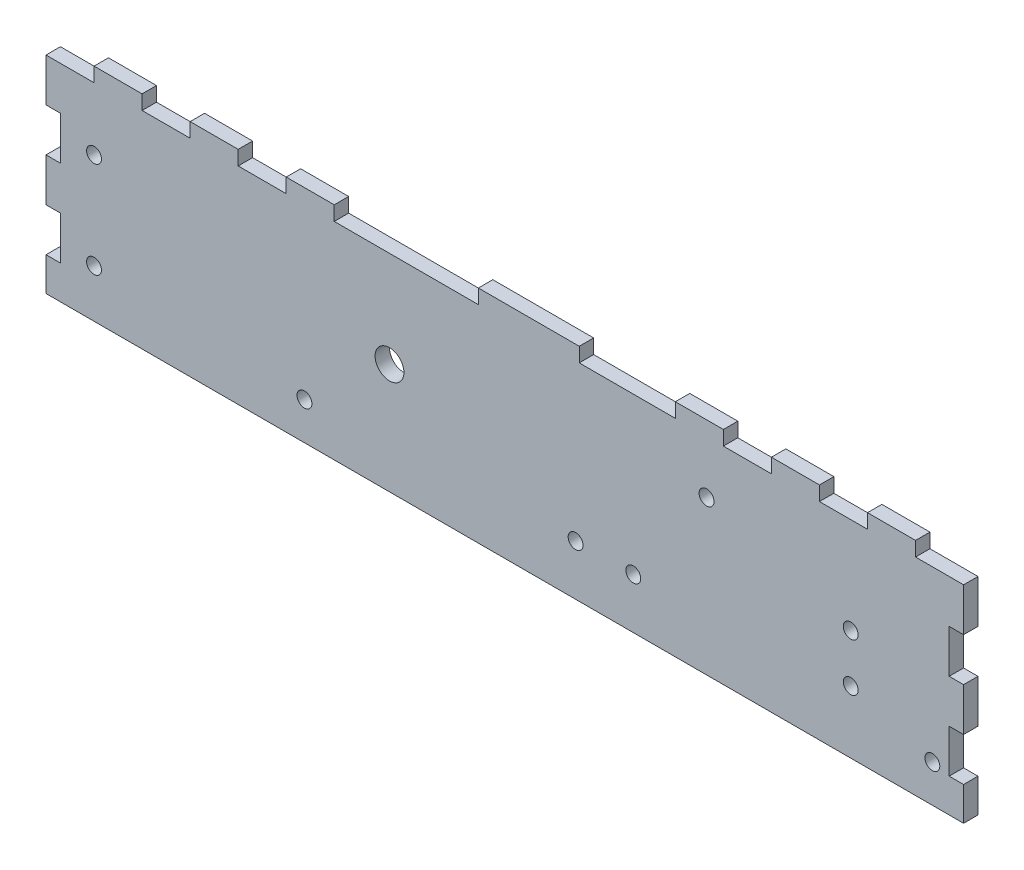
from build123d import *

# Parameters (mm, degrees)
SKETCH1_W           = 191
SKETCH1_H           = 46
SKETCH1_R           = 1.549999948
BOSS_EXTRUDE1_DEPTH = 3
CUT_EXTRUDE1_REACH  = 198.484
SKETCH3_W           = 10
SKETCH3_H           = 3
SKETCH3_W_2         = 30
SKETCH3_W_3         = 20
CUT_EXTRUDE2_REACH  = 198.484
SKETCH4_W           = 3
SKETCH4_H           = 9
CUT_EXTRUDE3_REACH  = 198.484
SKETCH6_R           = 3
CUT_EXTRUDE4_REACH  = 198.484
SKETCH7_R           = 1.55
CUT_EXTRUDE5_REACH  = 198.484
SKETCH8_R           = 1.55


with BuildPart() as part:
    # Sketch1 → Boss-Extrude1 (new body)
    with BuildSketch(Plane.XY):
        with Locations((-95.5, 23)):
            Rectangle(SKETCH1_W, SKETCH1_H)
        with Locations((-181, 30)):
            Circle(SKETCH1_R, mode=Mode.SUBTRACT)
        with Locations((-181, 10)):
            Circle(SKETCH1_R, mode=Mode.SUBTRACT)
    extrude(amount=BOSS_EXTRUDE1_DEPTH)

    # Sketch3 → Cut-Extrude1 (cut, up to next)
    with BuildSketch(Plane(origin=(0, 0, 0), x_dir=(-1, 0, 0), z_dir=(0, 0, -1)), mode=Mode.PRIVATE) as cut_extrude1_sk1:
        with Locations((45, 44.5)):
            Rectangle(SKETCH3_W, SKETCH3_H)
    cut_extrude1_tool1 = extrude(cut_extrude1_sk1.sketch, amount=-CUT_EXTRUDE1_REACH, mode=Mode.PRIVATE) & part.part
    # Sketch3 → Cut-Extrude1 (cut, up to next)
    with BuildSketch(Plane(origin=(0, 0, 0), x_dir=(-1, 0, 0), z_dir=(0, 0, -1)), mode=Mode.PRIVATE) as cut_extrude1_sk2:
        with Locations((25, 44.5)):
            Rectangle(SKETCH3_W, SKETCH3_H)
    cut_extrude1_tool2 = extrude(cut_extrude1_sk2.sketch, amount=-CUT_EXTRUDE1_REACH, mode=Mode.PRIVATE) & part.part
    # Sketch3 → Cut-Extrude1 (cut, up to next)
    with BuildSketch(Plane(origin=(0, 0, 0), x_dir=(-1, 0, 0), z_dir=(0, 0, -1)), mode=Mode.PRIVATE) as cut_extrude1_sk3:
        with Locations((5, 44.5)):
            Rectangle(SKETCH3_W, SKETCH3_H)
    cut_extrude1_tool3 = extrude(cut_extrude1_sk3.sketch, amount=-CUT_EXTRUDE1_REACH, mode=Mode.PRIVATE) & part.part
    # Sketch3 → Cut-Extrude1 (cut, up to next)
    with BuildSketch(Plane(origin=(0, 0, 0), x_dir=(-1, 0, 0), z_dir=(0, 0, -1)), mode=Mode.PRIVATE) as cut_extrude1_sk4:
        with Locations((166, 44.5)):
            Rectangle(SKETCH3_W, SKETCH3_H)
    cut_extrude1_tool4 = extrude(cut_extrude1_sk4.sketch, amount=-CUT_EXTRUDE1_REACH, mode=Mode.PRIVATE) & part.part
    # Sketch3 → Cut-Extrude1 (cut, up to next)
    with BuildSketch(Plane(origin=(0, 0, 0), x_dir=(-1, 0, 0), z_dir=(0, 0, -1)), mode=Mode.PRIVATE) as cut_extrude1_sk5:
        with Locations((146, 44.5)):
            Rectangle(SKETCH3_W, SKETCH3_H)
    cut_extrude1_tool5 = extrude(cut_extrude1_sk5.sketch, amount=-CUT_EXTRUDE1_REACH, mode=Mode.PRIVATE) & part.part
    # Sketch3 → Cut-Extrude1 (cut, up to next)
    with BuildSketch(Plane(origin=(0, 0, 0), x_dir=(-1, 0, 0), z_dir=(0, 0, -1)), mode=Mode.PRIVATE) as cut_extrude1_sk6:
        with Locations((116, 44.5)):
            Rectangle(SKETCH3_W_2, SKETCH3_H)
    cut_extrude1_tool6 = extrude(cut_extrude1_sk6.sketch, amount=-CUT_EXTRUDE1_REACH, mode=Mode.PRIVATE) & part.part
    # Sketch3 → Cut-Extrude1 (cut, up to next)
    with BuildSketch(Plane(origin=(0, 0, 0), x_dir=(-1, 0, 0), z_dir=(0, 0, -1)), mode=Mode.PRIVATE) as cut_extrude1_sk7:
        with Locations((70, 44.5)):
            Rectangle(SKETCH3_W_3, SKETCH3_H)
    cut_extrude1_tool7 = extrude(cut_extrude1_sk7.sketch, amount=-CUT_EXTRUDE1_REACH, mode=Mode.PRIVATE) & part.part
    # Sketch3 → Cut-Extrude1 (cut, up to next)
    with BuildSketch(Plane(origin=(0, 0, 0), x_dir=(-1, 0, 0), z_dir=(0, 0, -1)), mode=Mode.PRIVATE) as cut_extrude1_sk8:
        with Locations((186, 44.5)):
            Rectangle(SKETCH3_W, SKETCH3_H)
    cut_extrude1_tool8 = extrude(cut_extrude1_sk8.sketch, amount=-CUT_EXTRUDE1_REACH, mode=Mode.PRIVATE) & part.part
    add(cut_extrude1_tool1.solids().sort_by_distance((-45, 44.5, 0))[0], mode=Mode.SUBTRACT)
    add(cut_extrude1_tool2.solids().sort_by_distance((-25, 44.5, 0))[0], mode=Mode.SUBTRACT)
    add(cut_extrude1_tool3.solids().sort_by_distance((-5, 44.5, 0))[0], mode=Mode.SUBTRACT)
    add(cut_extrude1_tool4.solids().sort_by_distance((-166, 44.5, 0))[0], mode=Mode.SUBTRACT)
    add(cut_extrude1_tool5.solids().sort_by_distance((-146, 44.5, 0))[0], mode=Mode.SUBTRACT)
    add(cut_extrude1_tool6.solids().sort_by_distance((-116, 44.5, 0))[0], mode=Mode.SUBTRACT)
    add(cut_extrude1_tool7.solids().sort_by_distance((-70, 44.5, 0))[0], mode=Mode.SUBTRACT)
    add(cut_extrude1_tool8.solids().sort_by_distance((-186, 44.5, 0))[0], mode=Mode.SUBTRACT)

    # Sketch4 → Cut-Extrude2 (cut, up to next)
    with BuildSketch(Plane.XY.offset(3), mode=Mode.PRIVATE) as cut_extrude2_sk1:
        with Locations((-1.5, 29.5)):
            Rectangle(SKETCH4_W, SKETCH4_H)
    cut_extrude2_tool1 = extrude(cut_extrude2_sk1.sketch, amount=-CUT_EXTRUDE2_REACH, mode=Mode.PRIVATE) & part.part
    # Sketch4 → Cut-Extrude2 (cut, up to next)
    with BuildSketch(Plane.XY.offset(3), mode=Mode.PRIVATE) as cut_extrude2_sk2:
        with Locations((-1.5, 11.5)):
            Rectangle(SKETCH4_W, SKETCH4_H)
    cut_extrude2_tool2 = extrude(cut_extrude2_sk2.sketch, amount=-CUT_EXTRUDE2_REACH, mode=Mode.PRIVATE) & part.part
    cut_extrude2_1 = cut_extrude2_tool1.solids().sort_by_distance((-1.5, 29.5, 3))[0]
    add(cut_extrude2_1, mode=Mode.SUBTRACT)
    cut_extrude2_2 = cut_extrude2_tool2.solids().sort_by_distance((-1.5, 11.5, 3))[0]
    add(cut_extrude2_2, mode=Mode.SUBTRACT)
    cut_extrude2 = cut_extrude2_1 + cut_extrude2_2  # Cut-Extrude2 as one shape, for the pattern or mirror that repeats it

    # Mirror1: Cut-Extrude2 across plane
    add(cut_extrude2.mirror(Plane(origin=(-95.5, 0, 0), x_dir=(0, 0, 1), z_dir=(1, 0, 0))), mode=Mode.SUBTRACT)

    # Sketch6 → Cut-Extrude3 (cut, up to next)
    with BuildSketch(Plane.XY.offset(3), mode=Mode.PRIVATE) as cut_extrude3_sk1:
        with Locations((-119.5, 23)):
            Circle(SKETCH6_R)
    cut_extrude3_tool1 = extrude(cut_extrude3_sk1.sketch, amount=-CUT_EXTRUDE3_REACH, mode=Mode.PRIVATE) & part.part
    add(cut_extrude3_tool1.solids().sort_by_distance((-119.5, 23, 3))[0], mode=Mode.SUBTRACT)

    # Sketch7 → Cut-Extrude4 (cut, up to next)
    with BuildSketch(Plane.XY.offset(3), mode=Mode.PRIVATE) as cut_extrude4_sk1:
        with Locations((-53.5, 32)):
            Circle(SKETCH7_R)
    cut_extrude4_tool1 = extrude(cut_extrude4_sk1.sketch, amount=-CUT_EXTRUDE4_REACH, mode=Mode.PRIVATE) & part.part
    # Sketch7 → Cut-Extrude4 (cut, up to next)
    with BuildSketch(Plane.XY.offset(3), mode=Mode.PRIVATE) as cut_extrude4_sk2:
        with Locations((-68.757359313, 10.5)):
            Circle(SKETCH7_R)
    cut_extrude4_tool2 = extrude(cut_extrude4_sk2.sketch, amount=-CUT_EXTRUDE4_REACH, mode=Mode.PRIVATE) & part.part
    # Sketch7 → Cut-Extrude4 (cut, up to next)
    with BuildSketch(Plane.XY.offset(3), mode=Mode.PRIVATE) as cut_extrude4_sk3:
        with Locations((-80.757359313, 10.5)):
            Circle(SKETCH7_R)
    cut_extrude4_tool3 = extrude(cut_extrude4_sk3.sketch, amount=-CUT_EXTRUDE4_REACH, mode=Mode.PRIVATE) & part.part
    # Sketch7 → Cut-Extrude4 (cut, up to next)
    with BuildSketch(Plane.XY.offset(3), mode=Mode.PRIVATE) as cut_extrude4_sk4:
        with Locations((-23.5, 23)):
            Circle(SKETCH7_R)
    cut_extrude4_tool4 = extrude(cut_extrude4_sk4.sketch, amount=-CUT_EXTRUDE4_REACH, mode=Mode.PRIVATE) & part.part
    # Sketch7 → Cut-Extrude4 (cut, up to next)
    with BuildSketch(Plane.XY.offset(3), mode=Mode.PRIVATE) as cut_extrude4_sk5:
        with Locations((-23.5, 13)):
            Circle(SKETCH7_R)
    cut_extrude4_tool5 = extrude(cut_extrude4_sk5.sketch, amount=-CUT_EXTRUDE4_REACH, mode=Mode.PRIVATE) & part.part
    add(cut_extrude4_tool1.solids().sort_by_distance((-53.5, 32, 3))[0], mode=Mode.SUBTRACT)
    add(cut_extrude4_tool2.solids().sort_by_distance((-68.757359, 10.5, 3))[0], mode=Mode.SUBTRACT)
    add(cut_extrude4_tool3.solids().sort_by_distance((-80.757359, 10.5, 3))[0], mode=Mode.SUBTRACT)
    add(cut_extrude4_tool4.solids().sort_by_distance((-23.5, 23, 3))[0], mode=Mode.SUBTRACT)
    add(cut_extrude4_tool5.solids().sort_by_distance((-23.5, 13, 3))[0], mode=Mode.SUBTRACT)

    # Sketch8 → Cut-Extrude5 (cut, up to next)
    with BuildSketch(Plane(origin=(0, 0, 0), x_dir=(-1, 0, 0), z_dir=(0, 0, -1)), mode=Mode.PRIVATE) as cut_extrude5_sk1:
        with Locations((137.2, 7.8)):
            Circle(SKETCH8_R)
    cut_extrude5_tool1 = extrude(cut_extrude5_sk1.sketch, amount=-CUT_EXTRUDE5_REACH, mode=Mode.PRIVATE) & part.part
    # Sketch8 → Cut-Extrude5 (cut, up to next)
    with BuildSketch(Plane(origin=(0, 0, 0), x_dir=(-1, 0, 0), z_dir=(0, 0, -1)), mode=Mode.PRIVATE) as cut_extrude5_sk2:
        with Locations((6.5, 7.8)):
            Circle(SKETCH8_R)
    cut_extrude5_tool2 = extrude(cut_extrude5_sk2.sketch, amount=-CUT_EXTRUDE5_REACH, mode=Mode.PRIVATE) & part.part
    add(cut_extrude5_tool1.solids().sort_by_distance((-137.2, 7.8, 0))[0], mode=Mode.SUBTRACT)
    add(cut_extrude5_tool2.solids().sort_by_distance((-6.5, 7.8, 0))[0], mode=Mode.SUBTRACT)


solid = part.part
